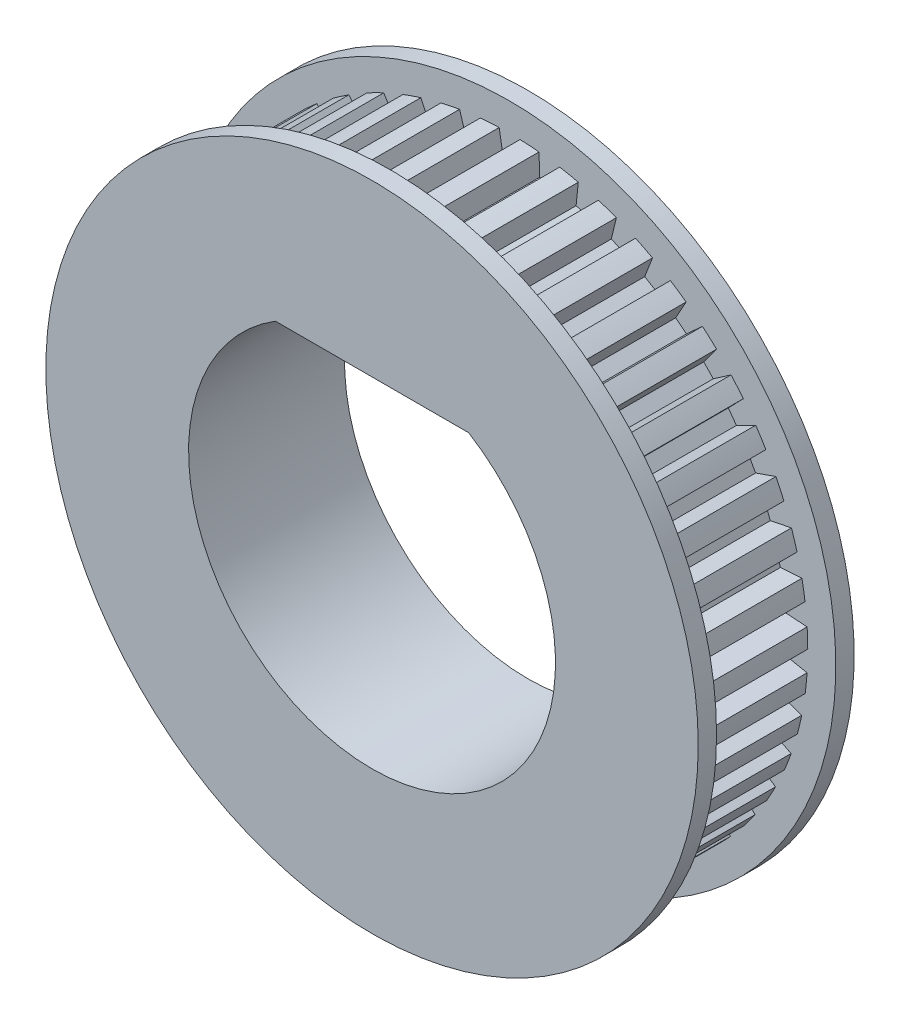
from build123d import *

# Parameters (mm, degrees)
SKETCH3_R               = 16.25
BOSS_EXTRUDE2_DEPTH     = 3.25
CUT_EXTRUDE2_DEPTH      = 24.209642393
CIRPATTERN3_COUNT       = 47
SKETCH5_R               = 17.78
BOSS_EXTRUDE3_DEPTH     = 1
BOSS_EXTRUDE4_START     = 1
SKETCH6_R               = 17.78
BOSS_EXTRUDE4_DEPTH     = 1
CUT_EXTRUDE3_DEPTH      = 27.542546977
CUT_EXTRUDE3_DEPTH_BACK = 27.542546977


with BuildPart() as part:
    # Sketch3 → Boss-Extrude2 (new, symmetric)
    with BuildSketch(Plane.XY):
        Circle(SKETCH3_R)
    extrude(amount=BOSS_EXTRUDE2_DEPTH, both=True)

    # Sketch1 → Cut-Extrude2 (cut, symmetric)
    with BuildSketch(Plane.XY):
        Polygon((-0.375, 15.08), (0.375, 15.08), (0.654345854, 16.756075122), (-0.654345854, 16.756075122), align=None)
    cut_extrude2 = extrude(amount=CUT_EXTRUDE2_DEPTH, both=True, mode=Mode.SUBTRACT)

    # CirPattern3: Cut-Extrude2 ×47 about axis
    cirpattern3_axis = Axis((0, 0, 3.25), (0, 0, 1))
    for i in range(1, CIRPATTERN3_COUNT):
        add(cut_extrude2.rotate(cirpattern3_axis, i * 360 / CIRPATTERN3_COUNT), mode=Mode.SUBTRACT)

    # Sketch5 → Boss-Extrude3 (add)
    with BuildSketch(Plane(origin=(0, 0, -3.25), x_dir=(-1, 0, 0), z_dir=(0, 0, -1))):
        Circle(SKETCH5_R)
    extrude(amount=BOSS_EXTRUDE3_DEPTH)

    # Sketch6 → Boss-Extrude4 (add)
    with BuildSketch(Plane.XY.offset(3.25).offset(BOSS_EXTRUDE4_START)):
        Circle(SKETCH6_R)
    extrude(amount=-BOSS_EXTRUDE4_DEPTH)

    # Sketch7 → Cut-Extrude3 (cut, two sides: drawn at the far end of the back side and taken through both)
    with BuildSketch(Plane.XY.offset(4.25).offset(-CUT_EXTRUDE3_DEPTH_BACK)):
        with BuildLine():
            Line((5.267826876, 8.5), (-5.267826876, 8.5))
            ThreePointArc((-5.267826876, 8.5), (-4.864243581, -8.737226927), (10, 0))
            ThreePointArc((10, 0), (8.737226927, 4.864243581), (5.267826876, 8.5))
        make_face()
    extrude(amount=CUT_EXTRUDE3_DEPTH + CUT_EXTRUDE3_DEPTH_BACK, mode=Mode.SUBTRACT)


solid = part.part
